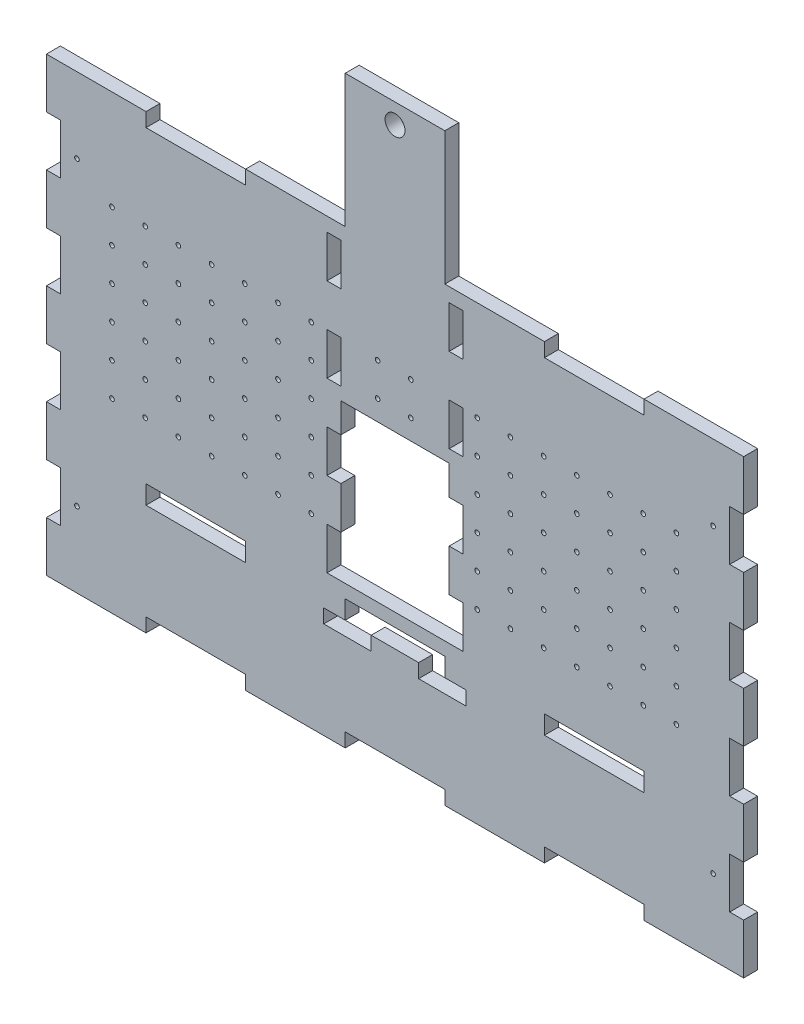
from build123d import *

# Parameters (mm, degrees)
SKETCH1_W           = 266.7
SKETCH1_H           = 172.72
BOSS_EXTRUDE1_DEPTH = 5.334
SKETCH2_W           = 38.1
SKETCH2_H           = 5.334
CUT_EXTRUDE1_DEPTH  = 165.701204222
SKETCH5_W           = 38.1
SKETCH5_H           = 7.112
CUT_EXTRUDE3_DEPTH  = 165.701204222
SKETCH8_W           = 18.149934459
SKETCH8_H           = 5.334
SKETCH8_W_2         = 18.14993446
CUT_EXTRUDE6_DEPTH  = 165.701204222
SKETCH9_W           = 5.334
SKETCH9_H           = 19.191111111
CUT_EXTRUDE7_DEPTH  = 165.701204222
SKETCH10_W          = 38.1
SKETCH10_H          = 5.334
BOSS_EXTRUDE2_DEPTH = 50.8
SKETCH11_W          = 6.604
SKETCH11_H          = 40.64
CUT_EXTRUDE8_DEPTH  = 197.710659379
SKETCH12_R          = 3.81
CUT_EXTRUDE9_DEPTH  = 197.710659379
SKETCH14_R          = 0.889
CUT_EXTRUDE11_DEPTH = 197.710659379
SKETCH15_W          = 6.604
SKETCH15_H          = 10.16
CUT_EXTRUDE12_DEPTH = 197.710659379
SKETCH16_W          = 41.402
SKETCH16_H          = 59.69
CUT_EXTRUDE13_DEPTH = 197.710659379
SKETCH17_W          = 5.334
SKETCH17_H          = 16.124650759
SKETCH17_H_2        = 16.124650758
CUT_EXTRUDE14_DEPTH = 197.710659379
SKETCH18_W          = 38.1
SKETCH18_H          = 56.134
BOSS_EXTRUDE3_DEPTH = 5.334
SKETCH19_W          = 34.756768033
SKETCH19_H          = 54.94363668
CUT_EXTRUDE15_DEPTH = 197.710659379
SKETCH20_R          = 3.81
CUT_EXTRUDE16_DEPTH = 197.710659379
SKETCH21_R          = 0.889
CUT_EXTRUDE17_DEPTH = 197.710659379


with BuildPart() as part:
    # Sketch1 → Boss-Extrude1 (new body)
    with BuildSketch(Plane.XY):
        with Locations((5.474099752, 2.104142138)):
            Rectangle(SKETCH1_W, SKETCH1_H)
    extrude(amount=BOSS_EXTRUDE1_DEPTH)

    # Sketch2 → Cut-Extrude1 (cut, through all)
    with BuildSketch(Plane.XY.offset(5.334)):
        with Locations((-70.725900248, -81.588857862)):
            Rectangle(SKETCH2_W, SKETCH2_H)
        with Locations((5.474099752, -81.588857862)):
            Rectangle(SKETCH2_W, SKETCH2_H)
        with Locations((81.674099752, -81.588857862)):
            Rectangle(SKETCH2_W, SKETCH2_H)
        with Locations((81.674099752, 85.797142138)):
            Rectangle(SKETCH2_W, SKETCH2_H)
        with Locations((5.474099752, 85.797142138)):
            Rectangle(SKETCH2_W, SKETCH2_H)
        with Locations((-70.725900248, 85.797142138)):
            Rectangle(SKETCH2_W, SKETCH2_H)
    extrude(amount=-CUT_EXTRUDE1_DEPTH, mode=Mode.SUBTRACT)

    # Sketch5 → Cut-Extrude3 (cut, through all)
    with BuildSketch(Plane.XY.offset(5.334)):
        with Locations((-70.725900248, -38.378413173)):
            Rectangle(SKETCH5_W, SKETCH5_H)
        with Locations((5.474099752, -38.378413173)):
            Rectangle(SKETCH5_W, SKETCH5_H)
        with Locations((81.674099752, -38.378413173)):
            Rectangle(SKETCH5_W, SKETCH5_H)
    extrude(amount=-CUT_EXTRUDE3_DEPTH, mode=Mode.SUBTRACT)

    # Sketch8 → Cut-Extrude6 (cut, through all)
    with BuildSketch(Plane.XY.offset(5.334)):
        with Locations((-12.722736397, -44.601413173)):
            Rectangle(SKETCH8_W, SKETCH8_H)
        with Locations((23.577132522, -44.601413173)):
            Rectangle(SKETCH8_W_2, SKETCH8_H)
    extrude(amount=-CUT_EXTRUDE6_DEPTH, mode=Mode.SUBTRACT)

    # Sketch9 → Cut-Extrude7 (cut, through all)
    with BuildSketch(Plane.XY.offset(5.334)):
        with Locations((-125.208900248, -55.469191196)):
            Rectangle(SKETCH9_W, SKETCH9_H)
        with Locations((-125.208900248, -17.086968973)):
            Rectangle(SKETCH9_W, SKETCH9_H)
        with Locations((-125.208900248, 21.295253249)):
            Rectangle(SKETCH9_W, SKETCH9_H)
        with Locations((-125.208900248, 59.677475472)):
            Rectangle(SKETCH9_W, SKETCH9_H)
        with Locations((136.157099752, 59.677475472)):
            Rectangle(SKETCH9_W, SKETCH9_H)
        with Locations((136.157099752, 21.295253249)):
            Rectangle(SKETCH9_W, SKETCH9_H)
        with Locations((136.157099752, -17.086968973)):
            Rectangle(SKETCH9_W, SKETCH9_H)
        with Locations((136.157099752, -55.469191196)):
            Rectangle(SKETCH9_W, SKETCH9_H)
    extrude(amount=-CUT_EXTRUDE7_DEPTH, mode=Mode.SUBTRACT)

    # Sketch10 → Boss-Extrude2 (add)
    with BuildSketch(Plane(origin=(0, 88.464142138, 0), x_dir=(1, 0, 0), z_dir=(0, 1, 0))):
        with Locations((43.574099752, -2.667)):
            Rectangle(SKETCH10_W, SKETCH10_H)
    extrude(amount=BOSS_EXTRUDE2_DEPTH)

    # Sketch11 → Cut-Extrude8 (cut, through all)
    with BuildSketch(Plane(origin=(0, 0, 0), x_dir=(-1, 0, 0), z_dir=(0, 0, -1))):
        with Locations((-27.826099752, 108.784142138)):
            Rectangle(SKETCH11_W, SKETCH11_H)
    extrude(amount=-CUT_EXTRUDE8_DEPTH, mode=Mode.SUBTRACT)

    # Sketch12 → Cut-Extrude9 (cut, through all)
    with BuildSketch(Plane.XY.offset(5.334)):
        with Locations((43.574099752, 130.476471297)):
            Circle(SKETCH12_R)
    extrude(amount=-CUT_EXTRUDE9_DEPTH, mode=Mode.SUBTRACT)

    # Sketch14 → Cut-Extrude11 (cut, through all)
    with BuildSketch(Plane.XY.offset(5.334)):
        with Locations((-102.797588144, 50.364142138)):
            Circle(SKETCH14_R)
        with Locations((-90.097588144, 50.364142138)):
            Circle(SKETCH14_R)
        with Locations((-77.397588144, 50.364142138)):
            Circle(SKETCH14_R)
        with Locations((-64.697588144, 50.364142138)):
            Circle(SKETCH14_R)
        with Locations((-51.997588144, 50.364142138)):
            Circle(SKETCH14_R)
        with Locations((-39.297588144, 50.364142138)):
            Circle(SKETCH14_R)
        with Locations((-26.597588144, 50.364142138)):
            Circle(SKETCH14_R)
        with Locations((-1.197588144, 50.364142138)):
            Circle(SKETCH14_R)
        with Locations((11.502411856, 50.364142138)):
            Circle(SKETCH14_R)
        with Locations((36.902411856, 50.364142138)):
            Circle(SKETCH14_R)
        with Locations((49.602411856, 50.364142138)):
            Circle(SKETCH14_R)
        with Locations((62.302411856, 50.364142138)):
            Circle(SKETCH14_R)
        with Locations((75.002411856, 50.364142138)):
            Circle(SKETCH14_R)
        with Locations((87.702411856, 50.364142138)):
            Circle(SKETCH14_R)
        with Locations((100.402411856, 50.364142138)):
            Circle(SKETCH14_R)
        with Locations((113.102411856, 50.364142138)):
            Circle(SKETCH14_R)
        with Locations((-102.797588144, 37.664142138)):
            Circle(SKETCH14_R)
        with Locations((-90.097588144, 37.664142138)):
            Circle(SKETCH14_R)
        with Locations((-77.397588144, 37.664142138)):
            Circle(SKETCH14_R)
        with Locations((-64.697588144, 37.664142138)):
            Circle(SKETCH14_R)
        with Locations((-51.997588144, 37.664142138)):
            Circle(SKETCH14_R)
        with Locations((-39.297588144, 37.664142138)):
            Circle(SKETCH14_R)
        with Locations((-26.597588144, 37.664142138)):
            Circle(SKETCH14_R)
        with Locations((-1.197588144, 37.664142138)):
            Circle(SKETCH14_R)
        with Locations((11.502411856, 37.664142138)):
            Circle(SKETCH14_R)
        with Locations((36.902411856, 37.664142138)):
            Circle(SKETCH14_R)
        with Locations((49.602411856, 37.664142138)):
            Circle(SKETCH14_R)
        with Locations((62.302411856, 37.664142138)):
            Circle(SKETCH14_R)
        with Locations((75.002411856, 37.664142138)):
            Circle(SKETCH14_R)
        with Locations((87.702411856, 37.664142138)):
            Circle(SKETCH14_R)
        with Locations((100.402411856, 37.664142138)):
            Circle(SKETCH14_R)
        with Locations((113.102411856, 37.664142138)):
            Circle(SKETCH14_R)
        with Locations((-102.797588144, 24.964142138)):
            Circle(SKETCH14_R)
        with Locations((-90.097588144, 24.964142138)):
            Circle(SKETCH14_R)
        with Locations((-77.397588144, 24.964142138)):
            Circle(SKETCH14_R)
        with Locations((-64.697588144, 24.964142138)):
            Circle(SKETCH14_R)
        with Locations((-51.997588144, 24.964142138)):
            Circle(SKETCH14_R)
        with Locations((-39.297588144, 24.964142138)):
            Circle(SKETCH14_R)
        with Locations((-26.597588144, 24.964142138)):
            Circle(SKETCH14_R)
        with Locations((-1.197588144, 24.964142138)):
            Circle(SKETCH14_R)
        with Locations((11.502411856, 24.964142138)):
            Circle(SKETCH14_R)
        with Locations((36.902411856, 24.964142138)):
            Circle(SKETCH14_R)
        with Locations((49.602411856, 24.964142138)):
            Circle(SKETCH14_R)
        with Locations((62.302411856, 24.964142138)):
            Circle(SKETCH14_R)
        with Locations((75.002411856, 24.964142138)):
            Circle(SKETCH14_R)
        with Locations((87.702411856, 24.964142138)):
            Circle(SKETCH14_R)
        with Locations((100.402411856, 24.964142138)):
            Circle(SKETCH14_R)
        with Locations((113.102411856, 24.964142138)):
            Circle(SKETCH14_R)
        with Locations((-102.797588144, 12.264142138)):
            Circle(SKETCH14_R)
        with Locations((-90.097588144, 12.264142138)):
            Circle(SKETCH14_R)
        with Locations((-77.397588144, 12.264142138)):
            Circle(SKETCH14_R)
        with Locations((-64.697588144, 12.264142138)):
            Circle(SKETCH14_R)
        with Locations((-51.997588144, 12.264142138)):
            Circle(SKETCH14_R)
        with Locations((-39.297588144, 12.264142138)):
            Circle(SKETCH14_R)
        with Locations((-26.597588144, 12.264142138)):
            Circle(SKETCH14_R)
        with Locations((36.902411856, 12.264142138)):
            Circle(SKETCH14_R)
        with Locations((49.602411856, 12.264142138)):
            Circle(SKETCH14_R)
        with Locations((62.302411856, 12.264142138)):
            Circle(SKETCH14_R)
        with Locations((75.002411856, 12.264142138)):
            Circle(SKETCH14_R)
        with Locations((87.702411856, 12.264142138)):
            Circle(SKETCH14_R)
        with Locations((100.402411856, 12.264142138)):
            Circle(SKETCH14_R)
        with Locations((113.102411856, 12.264142138)):
            Circle(SKETCH14_R)
        with Locations((-102.797588144, -0.435857862)):
            Circle(SKETCH14_R)
        with Locations((-90.097588144, -0.435857862)):
            Circle(SKETCH14_R)
        with Locations((-77.397588144, -0.435857862)):
            Circle(SKETCH14_R)
        with Locations((-64.697588144, -0.435857862)):
            Circle(SKETCH14_R)
        with Locations((-51.997588144, -0.435857862)):
            Circle(SKETCH14_R)
        with Locations((-39.297588144, -0.435857862)):
            Circle(SKETCH14_R)
        with Locations((-26.597588144, -0.435857862)):
            Circle(SKETCH14_R)
        with Locations((-13.897588144, -0.435857862)):
            Circle(SKETCH14_R)
        with Locations((-1.197588144, -0.435857862)):
            Circle(SKETCH14_R)
        with Locations((11.502411856, -0.435857862)):
            Circle(SKETCH14_R)
        with Locations((24.202411856, -0.435857862)):
            Circle(SKETCH14_R)
        with Locations((36.902411856, -0.435857862)):
            Circle(SKETCH14_R)
        with Locations((49.602411856, -0.435857862)):
            Circle(SKETCH14_R)
        with Locations((62.302411856, -0.435857862)):
            Circle(SKETCH14_R)
        with Locations((75.002411856, -0.435857862)):
            Circle(SKETCH14_R)
        with Locations((87.702411856, -0.435857862)):
            Circle(SKETCH14_R)
        with Locations((100.402411856, -0.435857862)):
            Circle(SKETCH14_R)
        with Locations((113.102411856, -0.435857862)):
            Circle(SKETCH14_R)
        with Locations((-102.797588144, -13.135857862)):
            Circle(SKETCH14_R)
        with Locations((-90.097588144, -13.135857862)):
            Circle(SKETCH14_R)
        with Locations((-77.397588144, -13.135857862)):
            Circle(SKETCH14_R)
        with Locations((-64.697588144, -13.135857862)):
            Circle(SKETCH14_R)
        with Locations((-51.997588144, -13.135857862)):
            Circle(SKETCH14_R)
        with Locations((-39.297588144, -13.135857862)):
            Circle(SKETCH14_R)
        with Locations((-26.597588144, -13.135857862)):
            Circle(SKETCH14_R)
        with Locations((-13.897588144, -13.135857862)):
            Circle(SKETCH14_R)
        with Locations((-1.197588144, -13.135857862)):
            Circle(SKETCH14_R)
        with Locations((11.502411856, -13.135857862)):
            Circle(SKETCH14_R)
        with Locations((24.202411856, -13.135857862)):
            Circle(SKETCH14_R)
        with Locations((36.902411856, -13.135857862)):
            Circle(SKETCH14_R)
        with Locations((49.602411856, -13.135857862)):
            Circle(SKETCH14_R)
        with Locations((62.302411856, -13.135857862)):
            Circle(SKETCH14_R)
        with Locations((75.002411856, -13.135857862)):
            Circle(SKETCH14_R)
        with Locations((87.702411856, -13.135857862)):
            Circle(SKETCH14_R)
        with Locations((100.402411856, -13.135857862)):
            Circle(SKETCH14_R)
        with Locations((113.102411856, -13.135857862)):
            Circle(SKETCH14_R)
    extrude(amount=-CUT_EXTRUDE11_DEPTH, mode=Mode.SUBTRACT)

    # Sketch15 → Cut-Extrude12 (cut, through all)
    with BuildSketch(Plane.XY.offset(5.334)):
        with Locations((27.826099752, 134.184142138)):
            Rectangle(SKETCH15_W, SKETCH15_H)
    extrude(amount=-CUT_EXTRUDE12_DEPTH, mode=Mode.SUBTRACT)

    # Sketch16 → Cut-Extrude13 (cut, through all)
    with BuildSketch(Plane.XY.offset(5.334)):
        with Locations((5.474099752, 0.102586827)):
            Rectangle(SKETCH16_W, SKETCH16_H)
    extrude(amount=-CUT_EXTRUDE13_DEPTH, mode=Mode.SUBTRACT)

    # Sketch17 → Cut-Extrude14 (cut, through all)
    with BuildSketch(Plane.XY.offset(5.334)):
        with Locations((-17.893900248, -21.680087794)):
            Rectangle(SKETCH17_W, SKETCH17_H)
        with Locations((-17.893900248, 10.569213724)):
            Rectangle(SKETCH17_W, SKETCH17_H)
        with Locations((-17.893900248, 42.818515241)):
            Rectangle(SKETCH17_W, SKETCH17_H_2)
        with Locations((-17.893900248, 75.067816759)):
            Rectangle(SKETCH17_W, SKETCH17_H)
        with Locations((28.842099752, 75.067816759)):
            Rectangle(SKETCH17_W, SKETCH17_H)
        with Locations((28.842099752, 42.818515241)):
            Rectangle(SKETCH17_W, SKETCH17_H_2)
        with Locations((28.842099752, 10.569213724)):
            Rectangle(SKETCH17_W, SKETCH17_H)
        with Locations((28.842099752, -21.680087794)):
            Rectangle(SKETCH17_W, SKETCH17_H)
    extrude(amount=-CUT_EXTRUDE14_DEPTH, mode=Mode.SUBTRACT)

    # Sketch18 → Boss-Extrude3 (add)
    with BuildSketch(Plane.XY.offset(5.334)):
        with Locations((5.474099752, 111.197142138)):
            Rectangle(SKETCH18_W, SKETCH18_H)
    extrude(amount=-BOSS_EXTRUDE3_DEPTH)

    # Sketch19 → Cut-Extrude15 (cut, through all)
    with BuildSketch(Plane.XY.offset(5.334)):
        with Locations((48.506483768, 115.935960478)):
            Rectangle(SKETCH19_W, SKETCH19_H)
    extrude(amount=-CUT_EXTRUDE15_DEPTH, mode=Mode.SUBTRACT)

    # Sketch20 → Cut-Extrude16 (cut, through all)
    with BuildSketch(Plane.XY.offset(5.334)):
        with Locations((5.474099752, 131.644142138)):
            Circle(SKETCH20_R)
    extrude(amount=-CUT_EXTRUDE16_DEPTH, mode=Mode.SUBTRACT)

    # Sketch21 → Cut-Extrude17 (cut, through all)
    with BuildSketch(Plane.XY.offset(5.334)):
        with Locations((127.140099752, 59.677475471)):
            Circle(SKETCH21_R)
        with Locations((-116.191900248, 59.677475471)):
            Circle(SKETCH21_R)
        with Locations((-116.191900248, -55.469191196)):
            Circle(SKETCH21_R)
        with Locations((127.140099752, -55.469191196)):
            Circle(SKETCH21_R)
    extrude(amount=-CUT_EXTRUDE17_DEPTH, mode=Mode.SUBTRACT)


solid = part.part
